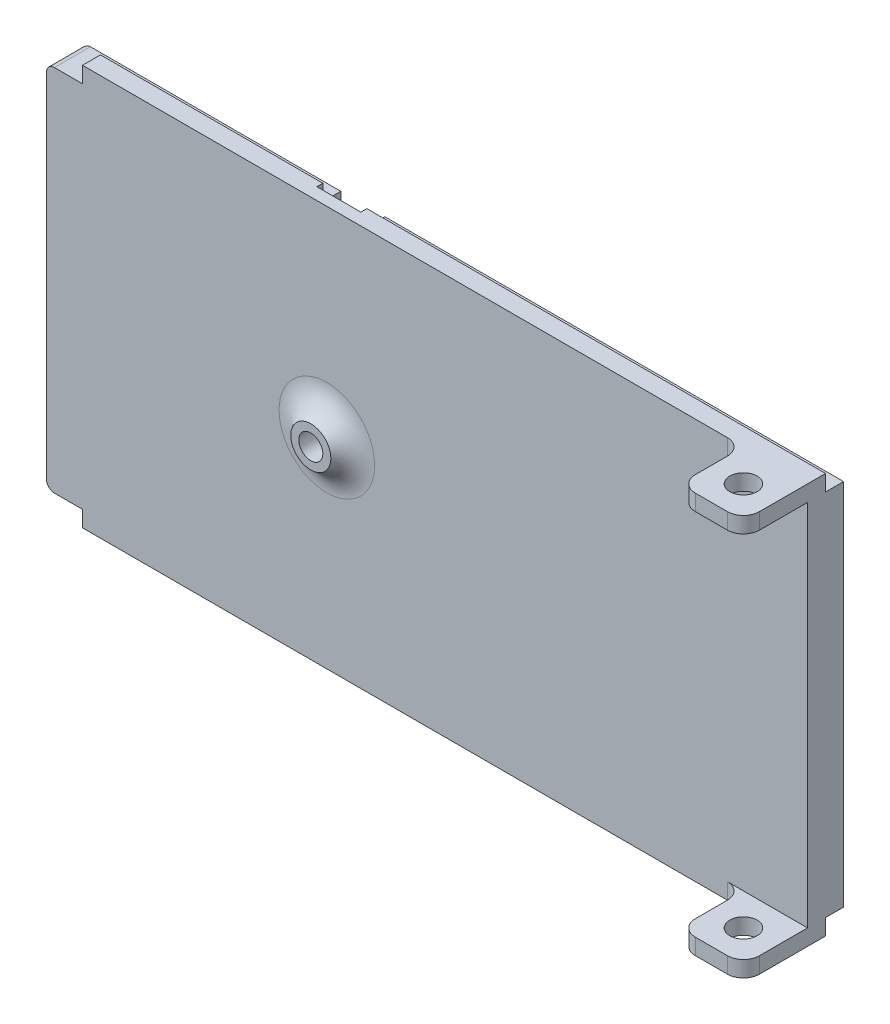
from build123d import *

# Parameters (mm, degrees)
SKETCH1_W               = 50
SKETCH1_H               = 95
BOSS_EXTRUDE1_DEPTH     = 4.5
SKETCH2_R               = 0.5
CUT_EXTRUDE1_DEPTH      = 108.448825028
SKETCH3_W               = 2
SKETCH3_H               = 2.25
CUT_EXTRUDE2_DEPTH      = 108.448825028
SKETCH5_R               = 2.5
BOSS_EXTRUDE2_DEPTH     = 2
SKETCH6_R               = 1.5
CUT_EXTRUDE3_DEPTH      = 108.551150621
FILLET1_R               = 4
SKETCH8_W               = 5.5
SKETCH8_H               = 30
CUT_EXTRUDE4_DEPTH      = 3
SKETCH10_W              = 2
SKETCH10_H              = 2.25
CUT_EXTRUDE5_DEPTH      = 4.5
FILLET2_R               = 1
SKETCH11_W              = 8
SKETCH11_H              = 2
BOSS_EXTRUDE3_DEPTH     = 8
CUT_EXTRUDE6_DEPTH      = 109.079831606
CUT_EXTRUDE6_DEPTH_BACK = 109.079831606
SKETCH12_R              = 1.7
FILLET3_R               = 2


with BuildPart() as part:
    # Sketch1 → Boss-Extrude1 (new body)
    with BuildSketch(Plane(origin=(0, 0, 0), x_dir=(0, 1, 0), z_dir=(0, 0, 1))):
        with Locations((25, 47.5)):
            Rectangle(SKETCH1_W, SKETCH1_H)
    extrude(amount=BOSS_EXTRUDE1_DEPTH)

    # Sketch2 → Cut-Extrude1 (cut, through all)
    with BuildSketch(Plane.XY.offset(4.5)):
        with Locations((-60, 25)):
            Circle(SKETCH2_R)
    extrude(amount=-CUT_EXTRUDE1_DEPTH, mode=Mode.SUBTRACT)

    # Sketch3 → Cut-Extrude2 (cut, through all)
    with BuildSketch(Plane(origin=(-95, 0, 0), x_dir=(0, -1, 0), z_dir=(-1, 0, 0))):
        with Locations((-49, 1.125)):
            Rectangle(SKETCH3_W, SKETCH3_H)
        with Locations((-1, 1.125)):
            Rectangle(SKETCH3_W, SKETCH3_H)
    extrude(amount=-CUT_EXTRUDE2_DEPTH, mode=Mode.SUBTRACT)

    # Sketch5 → Boss-Extrude2 (add)
    with BuildSketch(Plane.XY.offset(4.5)):
        with Locations(Location((-60, 25, 0), (0, 0, 180))):
            Circle(SKETCH5_R)
    extrude(amount=BOSS_EXTRUDE2_DEPTH)

    # Sketch6 → Cut-Extrude3 (cut, through all)
    with BuildSketch(Plane.XY.offset(6.5)):
        with Locations((-60, 25)):
            Circle(SKETCH6_R)
    extrude(amount=-CUT_EXTRUDE3_DEPTH, mode=Mode.SUBTRACT)

    # Fillet1
    # the kernel refuses this fillet: 4 mm, written as the material it adds along each edge
    with BuildSketch(Plane(origin=(-60, 25, 4.5), x_dir=(-1, 0, 0), z_dir=(0, 1, 0))) as fillet1_piece_1:
        with BuildLine():
            CenterArc((5.964101615, 4), FILLET1_R, 210, 60)
            Line((2.5, 2), (2.430717968, 1.96))
            ThreePointArc((2.430717968, 1.96), (2.42, 1), (2.42, 0))
            Line((2.42, 0), (2.5, -0.08))
            Line((2.5, -0.08), (5.964101615, -0.08))
            Line((5.964101615, -0.08), (5.964101615, 0))
        make_face()
    revolve(axis=Axis((-60, 25, 4.5), (0, 0, 1)))

    # Sketch8 → Cut-Extrude4 (cut)
    with BuildSketch(Plane(origin=(0, 0, 0), x_dir=(1, 0, 0), z_dir=(0, 0, -1))):
        with Locations((-60, -35)):
            Rectangle(SKETCH8_W, SKETCH8_H)
    extrude(amount=-CUT_EXTRUDE4_DEPTH, mode=Mode.SUBTRACT)

    # Sketch10 → Cut-Extrude5 (cut)
    with BuildSketch(Plane(origin=(-95, 0, 0), x_dir=(0, -1, 0), z_dir=(-1, 0, 0))):
        with Locations((-49, 3.375)):
            Rectangle(SKETCH10_W, SKETCH10_H)
        with Locations((-1, 3.375)):
            Rectangle(SKETCH10_W, SKETCH10_H)
    extrude(amount=-CUT_EXTRUDE5_DEPTH, mode=Mode.SUBTRACT)

    # Fillet2
    fillet2_edges = [part.edges().sort_by_distance(p)[0] for p in [
        (-95, 25, 0),
        (-95, 48, 2.25),
        (-95, 2, 2.25),
    ]]
    fillet(fillet2_edges, radius=FILLET2_R)

    # Sketch11 → Boss-Extrude3 (add)
    with BuildSketch(Plane.XY.offset(4.5)):
        with Locations((-4, 49)):
            Rectangle(SKETCH11_W, SKETCH11_H)
        with Locations((-4, 1)):
            Rectangle(SKETCH11_W, SKETCH11_H)
    extrude(amount=BOSS_EXTRUDE3_DEPTH)

    # Sketch12 → Cut-Extrude6 (cut, two sides: drawn at the far end of the back side and taken through both)
    with BuildSketch(Plane(origin=(0, 50, 0), x_dir=(-1, 0, 0), z_dir=(0, 1, 0)).offset(-CUT_EXTRUDE6_DEPTH_BACK)):
        with Locations((4, 8.5)):
            Circle(SKETCH12_R)
    extrude(amount=CUT_EXTRUDE6_DEPTH + CUT_EXTRUDE6_DEPTH_BACK, mode=Mode.SUBTRACT)

    # Fillet3
    fillet3_edges = [part.edges().sort_by_distance(p)[0] for p in [
        (-8, 49, 4.5),
        (0, 49, 12.5),
        (-8, 49, 12.5),
        (-8, 1, 4.5),
        (0, 1, 12.5),
        (-8, 1, 12.5),
    ]]
    fillet(fillet3_edges, radius=FILLET3_R)


solid = part.part
